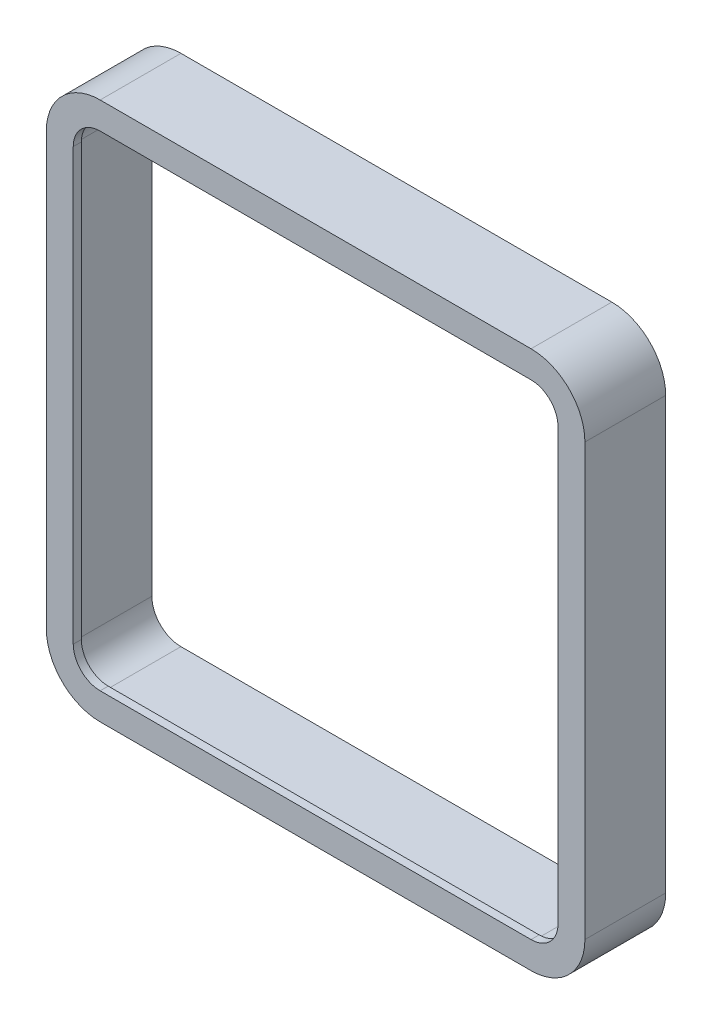
from build123d import *

# Parameters (mm, degrees)
SKETCH2_W           = 200
SKETCH2_H           = 200
BOSS_EXTRUDE1_DEPTH = 30
FILLET1_R           = 20
CUT_EXTRUDE1_DEPTH  = 3
CUT_EXTRUDE2_DEPTH  = 144.975692393


with BuildPart() as part:
    # Sketch2 → Boss-Extrude1 (new body)
    with BuildSketch(Plane.XY):
        Rectangle(SKETCH2_W, SKETCH2_H)
    extrude(amount=BOSS_EXTRUDE1_DEPTH)

    # Fillet1
    fillet1_edges = [part.edges().sort_by_distance(p)[0] for p in [
        (-100, -100, 15),
        (100, -100, 15),
        (100, 100, 15),
        (-100, 100, 15),
    ]]
    fillet(fillet1_edges, radius=FILLET1_R)

    # Sketch3 → Cut-Extrude1 (cut)
    with BuildSketch(Plane.XY.offset(30)):
        with BuildLine():
            Line((-90, 80), (-90, -80))
            ThreePointArc((-90, -80), (-87.071067812, -87.071067812), (-80, -90))
            Line((-80, -90), (80, -90))
            ThreePointArc((80, -90), (87.071067812, -87.071067812), (90, -80))
            Line((90, -80), (90, 80))
            ThreePointArc((90, 80), (87.071067812, 87.071067812), (80, 90))
            Line((80, 90), (-80, 90))
            ThreePointArc((-80, 90), (-87.071067812, 87.071067812), (-90, 80))
        make_face()
    extrude(amount=-CUT_EXTRUDE1_DEPTH, mode=Mode.SUBTRACT)

    # Sketch4 → Cut-Extrude2 (cut, through all)
    with BuildSketch(Plane.XY.offset(27)):
        with BuildLine():
            Line((-90.8, 80), (-90.8, -80))
            ThreePointArc((-90.8, -80), (-87.636753237, -87.636753237), (-80, -90.8))
            Line((-80, -90.8), (80, -90.8))
            ThreePointArc((80, -90.8), (87.636753237, -87.636753237), (90.8, -80))
            Line((90.8, -80), (90.8, 80))
            ThreePointArc((90.8, 80), (87.636753237, 87.636753237), (80, 90.8))
            Line((80, 90.8), (-80, 90.8))
            ThreePointArc((-80, 90.8), (-87.636753237, 87.636753237), (-90.8, 80))
        make_face()
    extrude(amount=-CUT_EXTRUDE2_DEPTH, mode=Mode.SUBTRACT)


solid = part.part
